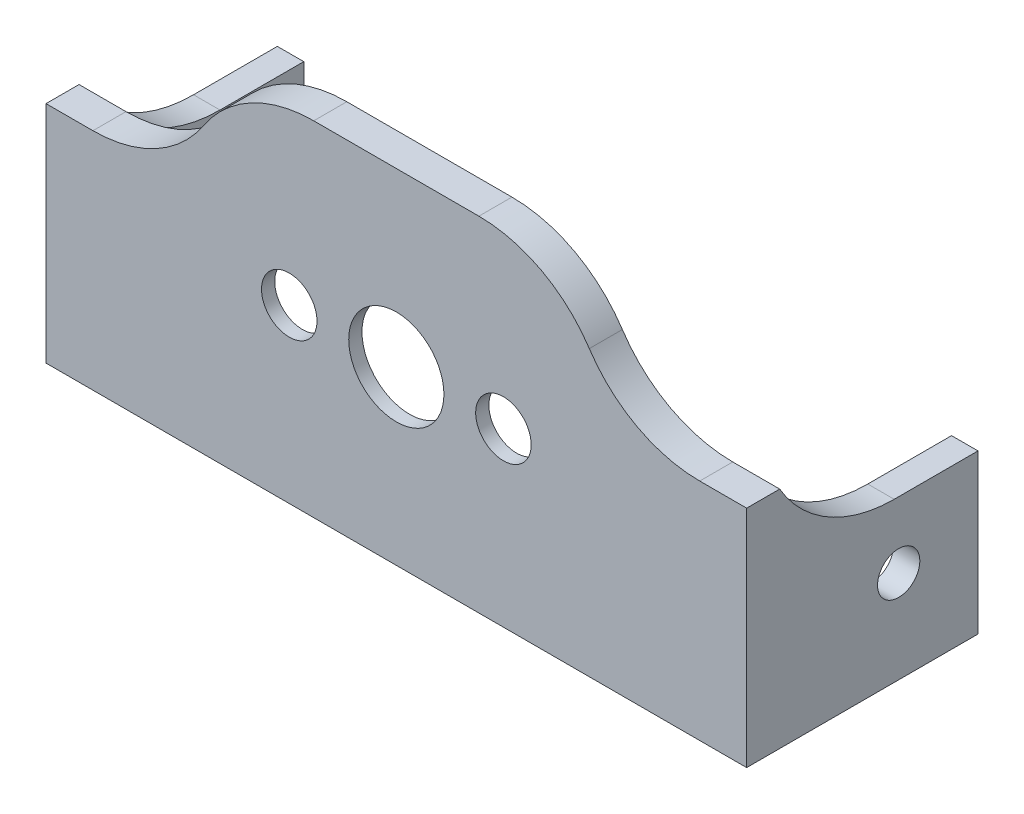
from build123d import *

# Parameters (mm, degrees)
BOSS_EXTRUDE1_DEPTH = 2.5
SKETCH4_R           = 12.55
CUT_EXTRUDE1_DEPTH  = 1.5
CUT_EXTRUDE2_REACH  = 33.444
SKETCH5_R           = 2.1
SKETCH5_R_2         = 3.6
SKETCH8_W           = 2
SKETCH8_H           = 12
BOSS_EXTRUDE3_DEPTH = 15
FILLET3_R           = 10
FILLET4_R           = 10
SKETCH9_R           = 1.6
CUT_EXTRUDE3_DEPTH  = 58.050444972


with BuildPart() as part:
    # Sketch3 → Boss-Extrude1 (new body)
    with BuildSketch(Plane.XY):
        Polygon((-11.828665208, 11.142231947), (14.171334792, 11.142231947), (14.171334792, 2.142231947), (27.671334792, 2.142231947), (27.671334792, -14.857768053), (-25.328665208, -14.857768053), (-25.328665208, 2.142231947), (-11.828665208, 2.142231947), align=None)
    extrude(amount=BOSS_EXTRUDE1_DEPTH)

    # Sketch4 → Cut-Extrude1 (cut)
    with BuildSketch(Plane(origin=(0, 0, 0), x_dir=(-1, 0, 0), z_dir=(0, 0, -1))):
        with Locations((-1.171334792, -1.857768053)):
            Circle(SKETCH4_R)
    extrude(amount=-CUT_EXTRUDE1_DEPTH, mode=Mode.SUBTRACT)

    # Sketch5 → Cut-Extrude2 (cut, up to next)
    with BuildSketch(Plane(origin=(0, 0, 1.5), x_dir=(-1, 0, 0), z_dir=(0, 0, -1)), mode=Mode.PRIVATE) as cut_extrude2_sk1:
        with Locations((-9.271334792, -1.857768053)):
            Circle(SKETCH5_R)
    cut_extrude2_tool1 = extrude(cut_extrude2_sk1.sketch, amount=-CUT_EXTRUDE2_REACH, mode=Mode.PRIVATE) & part.part
    # Sketch5 → Cut-Extrude2 (cut, up to next)
    with BuildSketch(Plane(origin=(0, 0, 1.5), x_dir=(-1, 0, 0), z_dir=(0, 0, -1)), mode=Mode.PRIVATE) as cut_extrude2_sk2:
        with Locations(Location((6.928665208, -1.857768053, 0), (0, 0, 180))):
            Circle(SKETCH5_R)
    cut_extrude2_tool2 = extrude(cut_extrude2_sk2.sketch, amount=-CUT_EXTRUDE2_REACH, mode=Mode.PRIVATE) & part.part
    # Sketch5 → Cut-Extrude2 (cut, up to next)
    with BuildSketch(Plane(origin=(0, 0, 1.5), x_dir=(-1, 0, 0), z_dir=(0, 0, -1)), mode=Mode.PRIVATE) as cut_extrude2_sk3:
        with Locations((-1.171334792, -1.857768053)):
            Circle(SKETCH5_R_2)
    cut_extrude2_tool3 = extrude(cut_extrude2_sk3.sketch, amount=-CUT_EXTRUDE2_REACH, mode=Mode.PRIVATE) & part.part
    add(cut_extrude2_tool1.solids().sort_by_distance((9.271335, -1.857768, 1.5))[0], mode=Mode.SUBTRACT)
    add(cut_extrude2_tool2.solids().sort_by_distance((-6.928665, -1.857768, 1.5))[0], mode=Mode.SUBTRACT)
    add(cut_extrude2_tool3.solids().sort_by_distance((1.171335, -1.857768, 1.5))[0], mode=Mode.SUBTRACT)

    # Sketch8 → Boss-Extrude3 (add)
    with BuildSketch(Plane(origin=(0, 0, 0), x_dir=(-1, 0, 0), z_dir=(0, 0, -1))):
        with Locations((-26.671334792, -8.857768053)):
            Rectangle(SKETCH8_W, SKETCH8_H)
        with Locations((24.328665208, -8.857768053)):
            Rectangle(SKETCH8_W, SKETCH8_H)
    extrude(amount=BOSS_EXTRUDE3_DEPTH)

    # Fillet3
    # the kernel refuses this fillet: 10 mm, written as the material it adds along each edge
    with BuildSketch(Plane(origin=(-11.828665208, 2.142231947, 0), x_dir=(-1, 0, 0), z_dir=(0, 0, 1))) as fillet3_piece_1:
        with BuildLine():
            CenterArc((9.949874371, -10), FILLET3_R, 90, 84.260829523)
            Line((0, -9), (-0.198997487, -8.98))
            ThreePointArc((-0.198997487, -8.98), (-0.2, -4.5), (-0.2, 0))
            Line((-0.2, 0), (0, 0.2))
            Line((0, 0.2), (9.949874371, 0.2))
            Line((9.949874371, 0.2), (9.949874371, 0))
        make_face()
    extrude(amount=2.5)
    with BuildSketch(Plane(origin=(14.171334792, 2.142231947, 0), x_dir=(1, 0, 0), z_dir=(0, 0, 1))) as fillet3_piece_2:
        with BuildLine():
            CenterArc((9.949874371, 10), FILLET3_R, 185.739170477, 84.260829523)
            Line((0, 9), (-0.198997487, 8.98))
            ThreePointArc((-0.198997487, 8.98), (-0.2, 4.5), (-0.2, 0))
            Line((-0.2, 0), (0, -0.2))
            Line((0, -0.2), (9.949874371, -0.2))
            Line((9.949874371, -0.2), (9.949874371, 0))
        make_face()
    extrude(amount=2.5)
    with BuildSketch(Plane(origin=(-23.328665208, -2.857768053, 0), x_dir=(0, 0, -1), z_dir=(-1, 0, 0)), Plane(origin=(27.671334792, -2.857768053, 0), x_dir=(0, 0, -1), z_dir=(-1, 0, 0))) as fillet3_piece_3:
        with BuildLine():
            CenterArc((8.660254038, -10), FILLET3_R, 90, 60)
            Line((0, -5), (-0.173205081, -4.9))
            ThreePointArc((-0.173205081, -4.9), (-0.2, -2.5), (-0.2, 0))
            Line((-0.2, 0), (0, 0.2))
            Line((0, 0.2), (8.660254038, 0.2))
            Line((8.660254038, 0.2), (8.660254038, 0))
        make_face()
    extrude(amount=2)

    # Fillet4
    fillet4_edges = [part.edges().sort_by_distance(p)[0] for p in [
        (-11.828665208, 11.142231947, 1.25),
        (14.171334792, 11.142231947, 1.25),
    ]]
    fillet(fillet4_edges, radius=FILLET4_R)

    # Sketch9 → Cut-Extrude3 (cut, through all)
    with BuildSketch(Plane(origin=(27.671334792, 0, 0), x_dir=(0, 0, -1), z_dir=(1, 0, 0))):
        with Locations((9, -7.857768053)):
            Circle(SKETCH9_R)
    extrude(amount=-CUT_EXTRUDE3_DEPTH, mode=Mode.SUBTRACT)


solid = part.part
